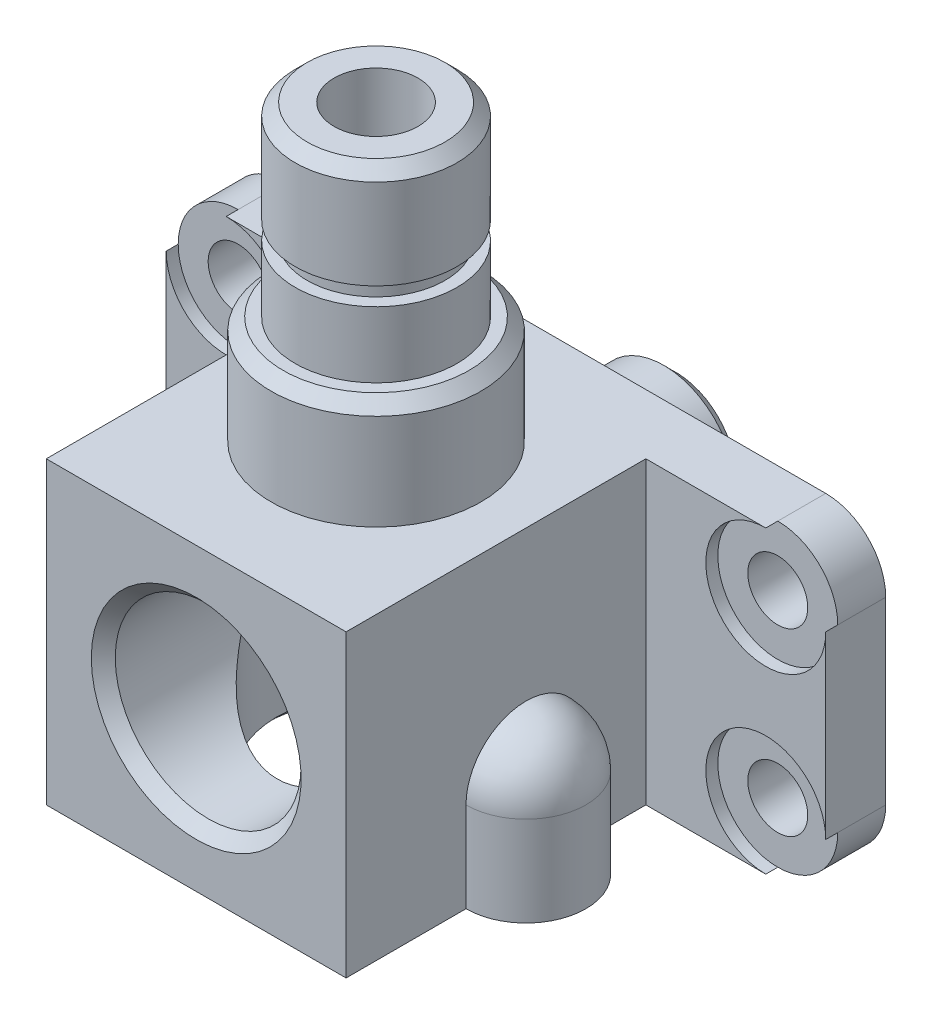
from build123d import *

# Parameters (mm, degrees)
SKETCH1_W                   = 50
SKETCH1_H                   = 110
BOSS_EXTRUDE1_DEPTH         = 10
FILLET1_R                   = 10
SKETCH3_W                   = 50
SKETCH3_H                   = 50
BOSS_EXTRUDE2_DEPTH         = 60
SKETCH4_R                   = 14
BOSS_EXTRUDE3_DEPTH         = 12
SKETCH5_R                   = 12
BOSS_EXTRUDE4_DEPTH         = 20
HOLE1_D                     = 10
HOLE1_CBORE_D               = 20
HOLE1_CBORE_DEPTH           = 2
HOLE2_D                     = 14
HOLE2_CBORE_D               = 33
HOLE2_CBORE_DEPTH           = 44
M33X2_0_TAPPED_HOLE1_REACH  = 124.07
M33X2_0_TAPPED_HOLE1_BORE_R = 15.5
HOLE4_D                     = 18
HOLE4_CBORE_D               = 30
HOLE4_CBORE_DEPTH           = 22
CHAMFER3_SIZE               = 2


with BuildPart() as part:
    # Sketch1 → Boss-Extrude1 (new body)
    with BuildSketch(Plane(origin=(0, 0, 0), x_dir=(0, 1, 0), z_dir=(0, 0, 1))):
        Rectangle(SKETCH1_W, SKETCH1_H)
    extrude(amount=BOSS_EXTRUDE1_DEPTH)

    # Fillet1
    fillet1_edges = [part.edges().sort_by_distance(p)[0] for p in [
        (55, 25, 5),
        (55, -25, 5),
        (-55, -25, 5),
        (-55, 25, 5),
    ]]
    fillet(fillet1_edges, radius=FILLET1_R)

    # Sketch3 → Boss-Extrude2 (add)
    with BuildSketch(Plane(origin=(0, 0, 0), x_dir=(0, 1, 0), z_dir=(0, 0, 1))):
        Rectangle(SKETCH3_W, SKETCH3_H)
    extrude(amount=BOSS_EXTRUDE2_DEPTH)

    # Sketch4 → Boss-Extrude3 (add)
    with BuildSketch(Plane(origin=(0, 0, 0), x_dir=(1, 0, 0), z_dir=(0, 0, -1))):
        with Locations(Location((0, 0, 0), (0, 0, 180))):
            Circle(SKETCH4_R)
    extrude(amount=BOSS_EXTRUDE3_DEPTH)

    # Sketch5 → Boss-Extrude4 (add)
    with BuildSketch(Plane(origin=(0, 0, 0), x_dir=(1, 0, 0), z_dir=(0, 0, -1))):
        with Locations(Location((0, 0, 0), (0, 0, 180))):
            Circle(SKETCH5_R)
    extrude(amount=BOSS_EXTRUDE4_DEPTH)

    # Sketch7 → Revolve1 (revolve)
    with BuildSketch(Plane(origin=(0, 0, 30), x_dir=(0, 1, 0), z_dir=(0, 0, 1)), mode=Mode.PRIVATE) as revolve1_sk:
        Polygon((25, 17.5), (43, 17.5), (43, 13.5), (54, 13.5), (54, 11.5), (57, 11.5), (57, 13.5), (74, 13.5), (74, 0), (25, 0), align=None)
    revolve(revolve1_sk.sketch.rotate(Axis((0, 0, 30), (0, 1, 0)), 270), axis=Axis((0, 0, 30), (0, 1, 0)))

    # Hole1 (through all)
    with Locations(Plane.XY.offset(10)):
        with Locations((-45, -15), (-45, 15)):
            hole1 = CounterBoreHole(HOLE1_D / 2, HOLE1_CBORE_D / 2, HOLE1_CBORE_DEPTH)

    # Mirror1: Hole1 across plane
    add(hole1.mirror(Plane(origin=(0, 0, 0), x_dir=(0, 0, 1), z_dir=(1, 0, 0))), mode=Mode.SUBTRACT)

    # Sketch12 → Revolve2 (revolve)
    with BuildSketch(Plane(origin=(0, 0, 30), x_dir=(0, 1, 0), z_dir=(0, 0, 1))):
        with BuildLine():
            Line((-25, 35), (-10, 35))
            ThreePointArc((-10, 35), (-2.928932188, 32.071067812), (0, 25))
            Line((0, 25), (-25, 25))
            Line((-25, 25), (-25, 35))
        make_face()
    revolve2 = revolve(axis=Axis((-25, 0, 30), (0, -1, 0)))

    # Mirror2: Revolve2 across plane
    add(revolve2.mirror(Plane(origin=(0, 0, 0), x_dir=(0, 0, 1), z_dir=(1, 0, 0))))

    # Hole2 (through all)
    with Locations(Plane.XZ.offset(25)):
        with Locations((0, 30)):
            CounterBoreHole(HOLE2_D / 2, HOLE2_CBORE_D / 2, HOLE2_CBORE_DEPTH)

    # Sketch16 → M10 Tapped Hole1 (revolve, cut)
    with BuildSketch(Plane(origin=(-25, -25, 30), x_dir=(0, 0, -1), z_dir=(1, 0, 0))):
        Polygon((0, 0), (0, 17.553657631), (4.25, 15), (4.25, 0), align=None)
    m10_tapped_hole1 = revolve(axis=Axis((-25, -31.35, 30), (0, 1, 0)), mode=Mode.SUBTRACT)

    # Mirror4: M10 Tapped Hole1 across plane
    add(m10_tapped_hole1.mirror(Plane(origin=(0, 0, 0), x_dir=(0, 0, 1), z_dir=(1, 0, 0))), mode=Mode.SUBTRACT)

    # M33x2.0 Tapped Hole1 bore → M33x2.0 Tapped Hole1 (cut, up to next)
    with BuildSketch(Plane.XY.offset(60), mode=Mode.PRIVATE) as m33x2_0_tapped_hole1_sk1:
        Circle(M33X2_0_TAPPED_HOLE1_BORE_R)
    m33x2_0_tapped_hole1_tool1 = extrude(m33x2_0_tapped_hole1_sk1.sketch, amount=-M33X2_0_TAPPED_HOLE1_REACH, mode=Mode.PRIVATE) & part.part
    add(m33x2_0_tapped_hole1_tool1.solids().sort_by_distance((0, 0, 60))[0], mode=Mode.SUBTRACT)

    # Hole4 (through all)
    with Locations(Plane(origin=(0, 0, 30), x_dir=(0, 1, 0), z_dir=(0, 0, 1))):
        with Locations((0, 0)):
            CounterBoreHole(HOLE4_D / 2, HOLE4_CBORE_D / 2, HOLE4_CBORE_DEPTH)

    # Chamfer3
    chamfer3_edges = [part.edges().sort_by_distance(p)[0] for p in [
        (-16.5, -25, 30),
        (-15.5, 0, 60),
        (14, 0, -12),
        (12, 0, -20),
        (0, 43, 47.5),
        (0, 74, 43.5),
    ]]
    chamfer(chamfer3_edges, length=CHAMFER3_SIZE - 0.0001)  # a hair under: the kernel refuses the full size


solid = part.part
